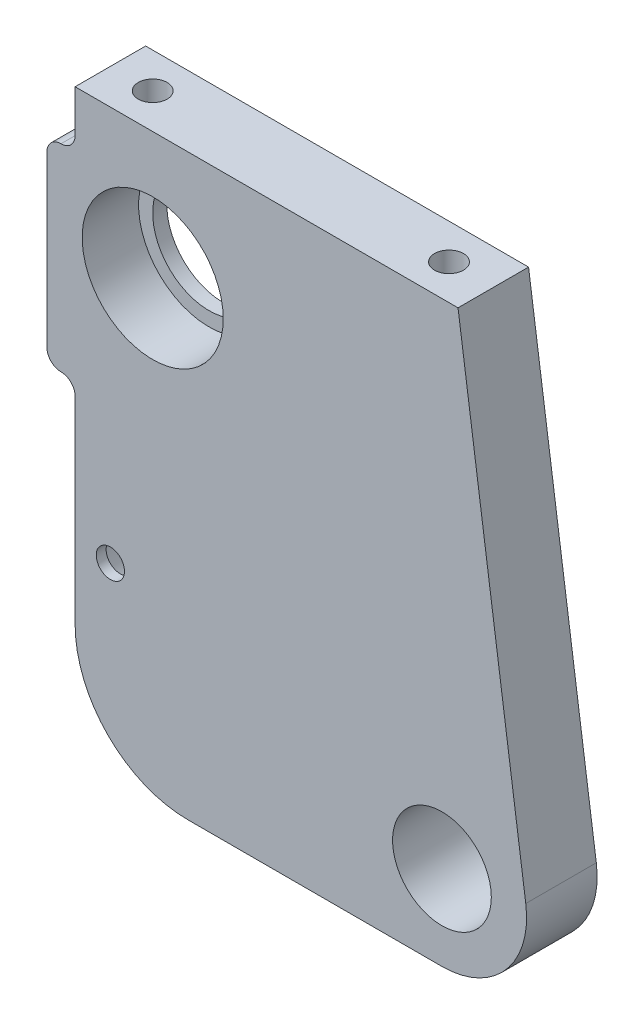
from build123d import *

# Parameters (mm, degrees)
SKETCH_1_W               = 34
SKETCH_1_H               = 41
EXTRUDE_1_DEPTH          = 5
FILLET_1_R               = 8
SKETCH_2_R               = 3.5
CUT_EXTRUDE_2_DEPTH      = 5
SKETCH_3_R               = 4
CUT_EXTRUDE_3_DEPTH      = 5
SKETCH_4_R               = 5
CUT_EXTRUDE_4_DEPTH      = 4
HOLE_WIZARD_M2_5_1_D     = 2.05
HOLE_WIZARD_M2_5_1_DEPTH = 7.35
HOLE_WIZARD_M2_5_1_TIP   = 0.615882135
CUT_EXTRUDE_5_DEPTH      = 5
SKETCH_8_R               = 1
CUT_EXTRUDE_6_DEPTH      = 5
CUT_EXTRUDE_7_DEPTH      = 2.5
SKETCH_10_R              = 3
CUT_EXTRUDE_8_DEPTH      = 1.8
SKETCH_20_W              = 5
SKETCH_20_H              = 12
EXTRUDE_1_2_DEPTH        = 3
FILLET_2_R               = 1
CUT_EXTRUDE_1_DEPTH      = 10
SKETCH_26_W              = 2
SKETCH_26_H              = 14
EXTRUDE_2_DEPTH          = 5
FILLET_3_R               = 1
FILLET_4_R               = 1
FILLET_5_R               = 1
FILLET_6_R               = 1


with BuildPart() as part:
    # 草图1 → Extrude 1 (new body)
    with BuildSketch(Plane.XY):
        with Locations((17, -20.5)):
            Rectangle(SKETCH_1_W, SKETCH_1_H)
    extrude(amount=EXTRUDE_1_DEPTH)

    # 圆角1
    fillet_1_edges = [part.edges().sort_by_distance(p)[0] for p in [
        (0, -41, 2.5),
    ]]
    fillet(fillet_1_edges, radius=FILLET_1_R)

    # 草图2 → 拉伸2 (cut)
    with BuildSketch(Plane.XY.offset(5)):
        with Locations((26, -35)):
            Circle(SKETCH_2_R)
    extrude(amount=-CUT_EXTRUDE_2_DEPTH, mode=Mode.SUBTRACT)

    # 草图3 → 拉伸3 (cut)
    with BuildSketch(Plane.XY.offset(5)):
        with Locations((5.5, -9)):
            Circle(SKETCH_3_R)
    extrude(amount=-CUT_EXTRUDE_3_DEPTH, mode=Mode.SUBTRACT)

    # 草图4 → 拉伸4 (cut)
    with BuildSketch(Plane.XY.offset(5)):
        with Locations((5.5, -9)):
            Circle(SKETCH_4_R)
    extrude(amount=-CUT_EXTRUDE_4_DEPTH, mode=Mode.SUBTRACT)

    # M2.5 螺纹孔1
    with Locations(Plane(origin=(3, 0, 2.5), x_dir=(0, 0, 1), z_dir=(0, 1, 0))):
        with Locations((0, 0), (0, 21)):
            Hole(HOLE_WIZARD_M2_5_1_D / 2, depth=HOLE_WIZARD_M2_5_1_DEPTH)
            with Locations((0, 0, -(HOLE_WIZARD_M2_5_1_DEPTH + HOLE_WIZARD_M2_5_1_TIP / 2))):  # 118° drill point
                Cone(0, HOLE_WIZARD_M2_5_1_D / 2, HOLE_WIZARD_M2_5_1_TIP, mode=Mode.SUBTRACT)

    # 草图7 → 拉伸5 (cut)
    with BuildSketch(Plane(origin=(0, 0, 0), x_dir=(-1, 0, 0), z_dir=(0, 0, -1))):
        with BuildLine():
            Line((-31.941608412, -34.164961394), (-27.140036221, 0))
            Line((-27.140036221, 0), (-34, 0))
            Line((-34, 0), (-34, -41))
            Line((-34, -41), (-26, -41))
            ThreePointArc((-26, -41), (-30.528257481, -38.936354174), (-31.941608412, -34.164961394))
        make_face()
    extrude(amount=-CUT_EXTRUDE_5_DEPTH, mode=Mode.SUBTRACT)

    # 草图8 → 拉伸6 (cut)
    with BuildSketch(Plane(origin=(0, 0, 0), x_dir=(-1, 0, 0), z_dir=(0, 0, -1))):
        with Locations((-2.5, -28)):
            Circle(SKETCH_8_R)
    extrude(amount=-CUT_EXTRUDE_6_DEPTH, mode=Mode.SUBTRACT)

    # 草图9 → 拉伸7 (cut)
    with BuildSketch(Plane(origin=(0, 0, 0), x_dir=(-1, 0, 0), z_dir=(0, 0, -1))):
        Polygon((-7.1, -31.099737486), (-0.5, -31.099737486), (-0.5, -30.7), (-0.5, -23.5), (-0.5, -22.1), (-1.9, -22.1), (-6.1, -22.1), (-7.5, -22.1), (-7.5, -23.5), (-7.5, -30.7), (-7.5, -31.099737486), align=None)
    extrude(amount=-CUT_EXTRUDE_7_DEPTH, mode=Mode.SUBTRACT)

    # 草图10 → 拉伸8 (cut)
    with BuildSketch(Plane(origin=(0, 0, 2.5), x_dir=(-1, 0, 0), z_dir=(0, 0, -1))):
        with Locations((-4, -28)):
            Circle(SKETCH_10_R)
    extrude(amount=-CUT_EXTRUDE_8_DEPTH, mode=Mode.SUBTRACT)

    # 草图20 → Extrude 1 2 (add)
    with BuildSketch(Plane.ZY):
        with Locations((2.5, -11)):
            Rectangle(SKETCH_20_W, SKETCH_20_H)
    extrude(amount=EXTRUDE_1_2_DEPTH)

    # 圆角2
    fillet_2_edges = [part.edges().sort_by_distance(p)[0] for p in [
        (0, -17, 2.5),
        (0, -5, 2.5),
        (-3, -17, 2.5),
        (-3, -5, 2.5),
    ]]
    fillet(fillet_2_edges, radius=FILLET_2_R)

    # 草图25 → 切除-拉伸1 (cut)
    with BuildSketch(Plane.XY.offset(5)):
        Polygon((0, 0), (0, -20.48158168), (-11.543504156, -18.602913064), (-5.133928875, -2.100098549), align=None)
    extrude(amount=-CUT_EXTRUDE_1_DEPTH, mode=Mode.SUBTRACT)

    # 草图26 → 凸台-拉伸2 (add)
    with BuildSketch(Plane.XY.offset(5)):
        with Locations((-1, -11)):
            Rectangle(SKETCH_26_W, SKETCH_26_H)
    extrude(amount=-EXTRUDE_2_DEPTH)

    # 圆角3
    fillet_3_edges = [part.edges().sort_by_distance(p)[0] for p in [
        (0, -4, 2.5),
    ]]
    fillet(fillet_3_edges, radius=FILLET_3_R)

    # 圆角4
    fillet_4_edges = [part.edges().sort_by_distance(p)[0] for p in [
        (0, -18, 2.5),
    ]]
    fillet(fillet_4_edges, radius=FILLET_4_R)

    # 圆角5
    fillet_5_edges = [part.edges().sort_by_distance(p)[0] for p in [
        (-2, -4, 2.5),
    ]]
    fillet(fillet_5_edges, radius=FILLET_5_R - 0.0001)  # a hair under: the kernel refuses the full size

    # 圆角6
    fillet_6_edges = [part.edges().sort_by_distance(p)[0] for p in [
        (-2, -18, 2.5),
    ]]
    fillet(fillet_6_edges, radius=FILLET_6_R - 0.0001)  # a hair under: the kernel refuses the full size


solid = part.part
